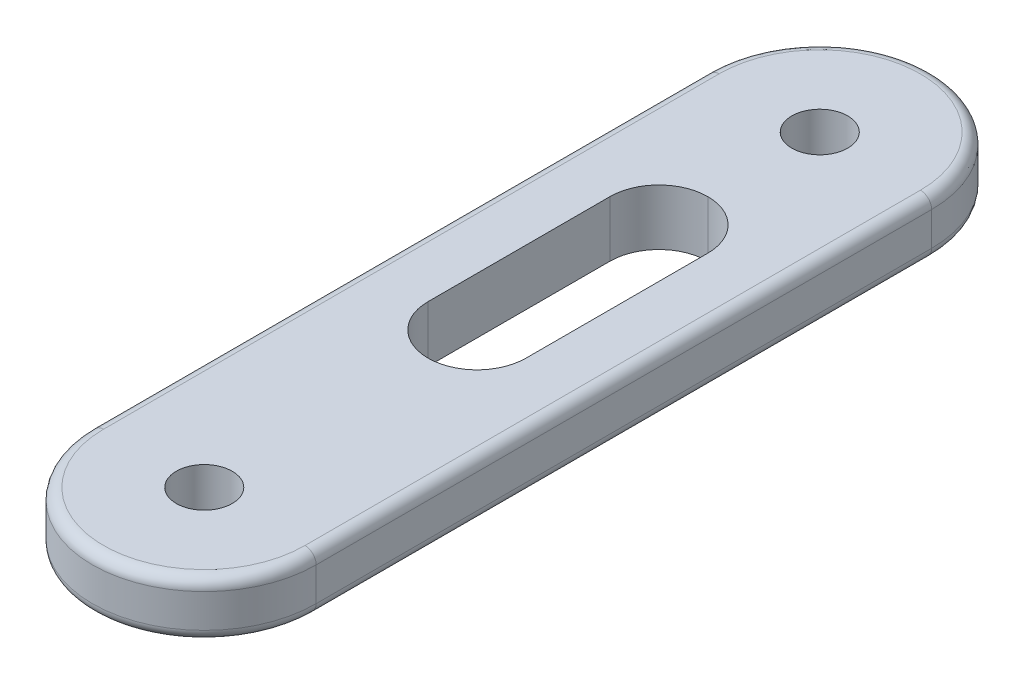
from build123d import *

# Parameters (mm, degrees)
SKETCH1_W           = 25.4
SKETCH1_H           = 95.25
SKETCH1_R           = 3.175
SKETCH1_W_2         = 11.1125
SKETCH1_H_2         = 31.75
BOSS_EXTRUDE1_DEPTH = 6.35
CUT_EXTRUDE1_DEPTH  = 99.782817332
FILLET1_R           = 1.27
FILLET2_R           = 5.55625


with BuildPart() as part:
    # Sketch1 → Boss-Extrude1 (new body)
    with BuildSketch(Plane(origin=(0, 0, 0), x_dir=(1, 0, 0), z_dir=(0, 1, 0))):
        with Locations((12.7, 47.625)):
            Rectangle(SKETCH1_W, SKETCH1_H)
        with Locations(Location((12.7, 82.55, 0), (0, 0, 270))):
            Circle(SKETCH1_R, mode=Mode.SUBTRACT)
        with Locations(Location((12.7, 12.7, 0), (0, 0, 270))):
            Circle(SKETCH1_R, mode=Mode.SUBTRACT)
        with Locations((12.7, 53.975)):
            Rectangle(SKETCH1_W_2, SKETCH1_H_2, mode=Mode.SUBTRACT)
    extrude(amount=BOSS_EXTRUDE1_DEPTH)

    # Sketch2 → Cut-Extrude1 (cut, through all)
    with BuildSketch(Plane(origin=(0, 6.35, 0), x_dir=(1, 0, 0), z_dir=(0, 1, 0))):
        with BuildLine():
            ThreePointArc((0, 82.549999981), (3.719743872, 91.530256114), (12.7, 95.25))
            Line((12.7, 95.25), (0, 95.25))
            Line((0, 95.25), (0, 82.549999981))
        make_face()
        with BuildLine():
            ThreePointArc((12.7, 95.25), (21.680256121, 91.530256121), (25.4, 82.55))
            Line((25.4, 82.55), (25.4, 95.25))
            Line((25.4, 95.25), (12.7, 95.25))
        make_face()
        with BuildLine():
            ThreePointArc((12.7, 0), (3.719743903, 3.719743855), (0, 12.699999932))
            Line((0, 12.699999932), (0, 0))
            Line((0, 0), (12.7, 0))
        make_face()
        with BuildLine():
            Line((25.4, 0), (25.4, 12.7))
            ThreePointArc((25.4, 12.7), (21.680256121, 3.719743879), (12.7, 0))
            Line((12.7, 0), (25.4, 0))
        make_face()
    extrude(amount=-CUT_EXTRUDE1_DEPTH, mode=Mode.SUBTRACT)

    # Fillet1
    fillet1_edges = [part.edges().sort_by_distance(p)[0] for p in [
        (25.4, 0, -47.625),
        (25.4, 6.35, -47.625),
        (0, 0, -47.624999957),
        (0, 6.35, -47.624999957),
        (12.69999999, 6.35, -95.25),
        (12.69999999, 0, -95.25),
        (12.700000034, 6.35, 0),
        (12.700000034, 0, 0),
    ]]
    fillet(fillet1_edges, radius=FILLET1_R)

    # Fillet2
    fillet2_edges = [part.edges().sort_by_distance(p)[0] for p in [
        (7.14375, 3.175, -38.1),
        (18.25625, 3.175, -38.1),
        (18.25625, 3.175, -69.85),
        (7.14375, 3.175, -69.85),
    ]]
    fillet(fillet2_edges, radius=FILLET2_R - 0.0001)  # a hair under: the kernel refuses the full size


solid = part.part
